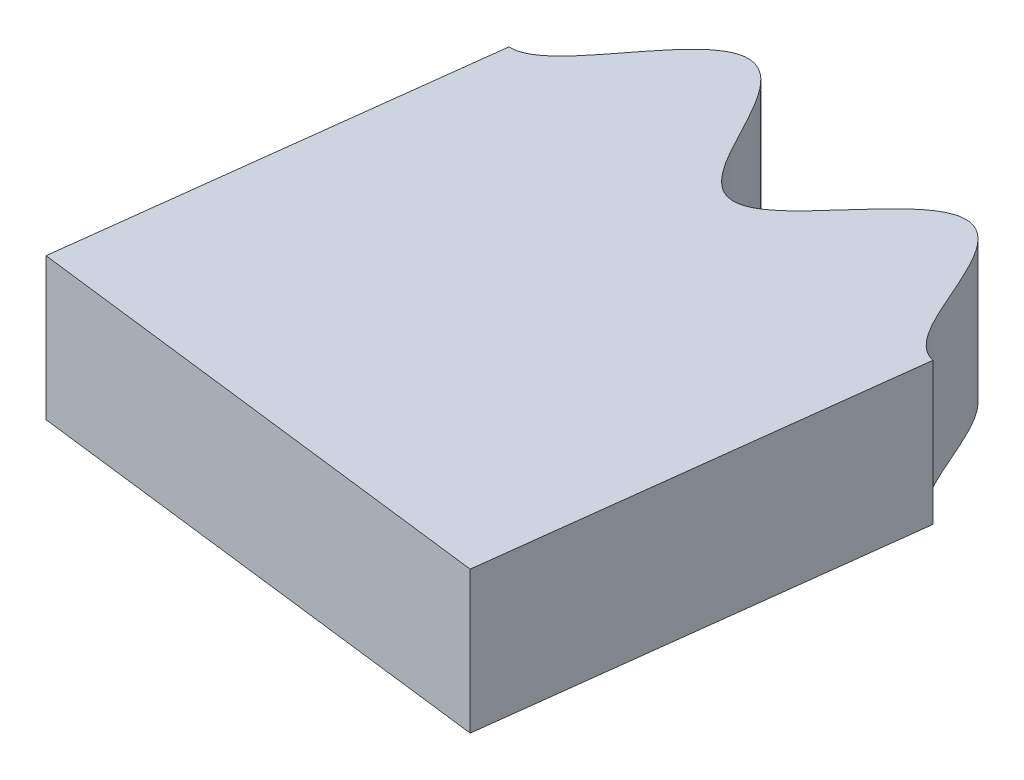
from build123d import *

# Parameters (mm, degrees)
BOSS_EXTRUDE1_DEPTH     = 3
CUT_EXTRUDE1_DEPTH      = 108.858671658
CUT_EXTRUDE1_DEPTH_BACK = 108.858671658
CUT_EXTRUDE2_START      = -3
CUT_EXTRUDE2_DEPTH      = 3
BOSS_EXTRUDE2_DEPTH     = 3


# Read off the part's stored shape, not the designer's step: Cut-Extrude2
with BuildPart() as part:
    # Sketch1 → Boss-Extrude1 (new body)
    with BuildSketch(Plane(origin=(0, 0, 0), x_dir=(1, 0, 0), z_dir=(0, 1, 0))):
        with BuildLine():
            Line((0, 75), (0, 65))
            ThreePointArc((0, 65), (45.961940777, 45.961940777), (65, 0))
            Line((65, 0), (75, 0))
            add(Edge.make_bspline(
                [(75, 0), (75.041112298, 0.027408199), (75.125245613, 0.083633523), (75.342933354, 0.230577442), (75.579476749, 0.400277398), (75.803954392, 0.581129453), (76.011836208, 0.790840237), (76.152032615, 0.978806109), (76.242410545, 1.19222257), (76.247194636, 1.417755828), (76.171590227, 1.621283712), (76.053040344, 1.792429827), (75.901720165, 1.952322234), (75.724822759, 2.103749443), (75.475174439, 2.288266037), (75.149562178, 2.499244919), (74.76260426, 2.733844059), (74.390525752, 2.967660926), (74.096998745, 3.180516485), (73.888021815, 3.373771754), (73.754852079, 3.533069478), (73.660678301, 3.715826875), (73.634383631, 3.916077063), (73.679915901, 4.107591164), (73.770283931, 4.275986246), (73.89449518, 4.439152777), (74.045788672, 4.598579928), (74.26557757, 4.798748111), (74.557807478, 5.033508593), (74.855966792, 5.260237371), (75.151185226, 5.491052123), (75.387608171, 5.691635418), (75.566675759, 5.859482286), (75.730748459, 6.039389733), (75.870288216, 6.236516843), (75.961581875, 6.45080996), (75.973056406, 6.672596723), (75.906427466, 6.870219289), (75.796783895, 7.031782356), (75.649110789, 7.183951163), (75.469925432, 7.327656175), (75.209020085, 7.502392039), (74.862370612, 7.698495981), (74.449730006, 7.911567611), (74.045765305, 8.125033195), (73.717888832, 8.324746291), (73.474215016, 8.516344263), (73.310194836, 8.687844958), (73.209978847, 8.874644977), (73.187392103, 9.054219472), (73.21525349, 9.232640914), (73.284935957, 9.401931792), (73.400574203, 9.579366787), (73.556680046, 9.766323154), (73.727550498, 9.942822403), (73.952817031, 10.156161772), (74.23307697, 10.405234115), (74.514063241, 10.65333411), (74.785870431, 10.911917317), (74.986481142, 11.131582376), (75.121662574, 11.30507905), (75.228863452, 11.479909983), (75.302210184, 11.65611955), (75.333173336, 11.858984022), (75.287269055, 12.074305866), (75.15847177, 12.268341055), (74.980105218, 12.432099829), (74.728460017, 12.606792631), (74.401490897, 12.782190319), (74.005435933, 12.96226152), (73.545966647, 13.159101964), (73.162792441, 13.336282191), (72.861677723, 13.505559024), (72.648318937, 13.666887707), (72.513794701, 13.801989012), (72.412981344, 13.965633699), (72.371963722, 14.15398098), (72.397238739, 14.344669957), (72.467507765, 14.522166656), (72.570326862, 14.69947357), (72.699548746, 14.877274653), (72.890625296, 15.105072213), (73.148030786, 15.377641411), (73.411870082, 15.643649024), (73.671714607, 15.913786401), (73.877113397, 16.146162464), (74.02997712, 16.338298376), (74.165497137, 16.540721782), (74.273001522, 16.75730721), (74.326194492, 16.981151402), (74.299446752, 17.194622932), (74.207844947, 17.370179186), (74.086475222, 17.505519053), (73.932240132, 17.628565522), (73.750457516, 17.740323675), (73.490079211, 17.871024763), (73.148041516, 18.010331828), (72.742635441, 18.15504136), (72.333783961, 18.299564956), (71.985228704, 18.438749066), (71.70124882, 18.580522318), (71.484211269, 18.720941323), (71.306471591, 18.895439186), (71.211655145, 19.112480641), (71.213690436, 19.332867892), (71.271629162, 19.528589428), (71.368375747, 19.727885068), (71.496696771, 19.930960938), (71.691975725, 20.19518494), (71.958922365, 20.515350742), (72.231412424, 20.830517708), (72.494647937, 21.153852313), (72.684260194, 21.422165122), (72.806947199, 21.628655642), (72.897284563, 21.830787556), (72.949258959, 22.027694797), (72.9483902, 22.242980954), (72.862768572, 22.453004372), (72.700947367, 22.62422926), (72.499570931, 22.758070634), (72.280988775, 22.865605493), (72.052538319, 22.95557), (71.758469571, 23.054113977), (71.398368953, 23.158137599), (71.036873596, 23.256587267), (70.677669314, 23.363936391), (70.398293383, 23.465676583), (70.197483409, 23.555045897), (70.019786006, 23.65718864), (69.870182882, 23.77577078), (69.752949584, 23.92827477), (69.694298319, 24.111897094), (69.699782913, 24.304024228), (69.748732194, 24.488287842), (69.852850212, 24.734680106), (70.028959091, 25.031841331), (70.272263328, 25.376858367), (70.534233789, 25.727055658), (70.753379001, 26.031183809), (70.923525506, 26.290634735), (71.04686175, 26.503046555), (71.150721004, 26.723540476), (71.223301141, 26.954542045), (71.238153459, 27.191377726), (71.165221919, 27.408965497), (71.023362715, 27.575720342), (70.853435387, 27.696006311), (70.656552657, 27.794499861), (70.438532503, 27.876292604), (70.140831352, 27.96429664), (69.762696965, 28.051186073), (69.31883777, 28.139289685), (68.889228305, 28.231747368), (68.540602233, 28.331373996), (68.278130966, 28.441500234), (68.098509316, 28.545644396), (67.947508202, 28.685170845), (67.854309696, 28.864351161), (67.831594354, 29.059888503), (67.858918015, 29.249035805), (67.919832168, 29.44484494), (68.00747425, 29.646402879), (68.145546704, 29.909671673), (68.339860179, 30.230222881), (68.542492477, 30.545254732), (68.740963766, 30.863120302), (68.894525136, 31.132468354), (69.005386617, 31.35143754), (69.098032551, 31.576611408), (69.161735589, 31.809575706), (69.174231004, 32.042169637), (69.109157996, 32.254505543), (68.978956374, 32.41742157), (68.820667296, 32.531740882), (68.629855171, 32.624225611), (68.412326004, 32.697979149), (68.10739199, 32.772942266), (67.71457654, 32.838658591), (67.253946418, 32.89774903), (66.80133424, 32.960177), (66.424925236, 33.035705563), (66.130416383, 33.132407411), (65.917631138, 33.237467143), (65.759569543, 33.378725855), (65.676926853, 33.539745562), (65.642084265, 33.716936029), (65.649663475, 33.899850226), (65.697641539, 34.10613519), (65.780390204, 34.335208051), (65.880589608, 34.55950423), (66.019304545, 34.837023353), (66.197474984, 35.166929341), (66.376660513, 35.496170039), (66.543635059, 35.832122305), (66.657017588, 36.107152844), (66.724707225, 36.316421161), (66.765647398, 36.517373358), (66.77430356, 36.708042248), (66.73401567, 36.909262517), (66.617235348, 37.095898676), (66.429841545, 37.234180845), (66.206223014, 37.327058803), (65.910005418, 37.405148613), (65.542765407, 37.458138501), (65.109007502, 37.491891304), (64.609924207, 37.519713065), (64.189259027, 37.555154721), (63.848407661, 37.611235612), (63.592738325, 37.689861983), (63.420119526, 37.770805683), (63.269416179, 37.89010119), (63.166453658, 38.053060886), (63.124984934, 38.240894476), (63.130308773, 38.431720236), (63.166284583, 38.633500438), (63.22690188, 38.844775291), (63.328543759, 39.124187005), (63.47720162, 39.468356136), (63.634149536, 39.808559872), (63.785931033, 40.151278046), (63.899465715, 40.439890622), (63.977394027, 40.672721895), (64.035519447, 40.909287616), (64.062433284, 41.149582493), (64.035284076, 41.383605964), (63.929433326, 41.584196387), (63.765072988, 41.72324517), (63.580824793, 41.810000008), (63.367915025, 41.870725461), (63.130872424, 41.909471311), (62.803452477, 41.936688044), (62.386559274, 41.94287342), (61.969974138, 41.936719345), (61.553122911, 41.938024966), (61.225192691, 41.958272522), (60.987144385, 41.990507568), (60.772287561, 42.044500152), (60.585113871, 42.125923892), (60.414979182, 42.266026963), (60.309662618, 42.478172132), (60.290238363, 42.726493689), (60.322180213, 42.983013696), (60.396114351, 43.291684998), (60.513540138, 43.648159637), (60.665633306, 44.054256018), (60.815369375, 44.457832583), (60.928511564, 44.809393514), (60.99575667, 45.092867907), (61.026992571, 45.303958226), (61.031873913, 45.501201906), (61.006212515, 45.681171299), (60.930609128, 45.864187738), (60.784273564, 46.02189455), (60.578607182, 46.125030643), (60.343590632, 46.181895936), (60.101414719, 46.208196838), (59.855971164, 46.214599016), (59.545932975, 46.206622868), (59.171970898, 46.181211372), (58.798604614, 46.150085143), (58.424347435, 46.128105202), (58.127022741, 46.128157521), (57.907756983, 46.143456148), (57.705841165, 46.178662838), (57.524702746, 46.23892632), (57.362380046, 46.342137045), (57.244463278, 46.494625665), (57.183905752, 46.677041955), (57.16688266, 46.866934943), (57.180442102, 47.134077334), (57.244321336, 47.473553641), (57.354893039, 47.880971366), (57.499445675, 48.359471859), (57.616082356, 48.7786151), (57.69189163, 49.141831437), (57.719823597, 49.446893215), (57.709028908, 49.688792031), (57.643178629, 49.912179891), (57.50773923, 50.085750824), (57.332433298, 50.192430443), (57.150302566, 50.249508911), (56.947466903, 50.279767431), (56.727667839, 50.287733986), (56.430444367, 50.275255132), (56.057644353, 50.233253122), (55.686973228, 50.177480147), (55.31602689, 50.122890282), (55.007795866, 50.087455177), (54.76278633, 50.070025875), (54.519099912, 50.070566496), (54.279131024, 50.099783795), (54.076955349, 50.171870632), (53.934932159, 50.286532738), (53.834139437, 50.434480373), (53.774948775, 50.603748659), (53.752200542, 50.810402358), (53.762075931, 51.120092353), (53.819834522, 51.49970215), (53.915977976, 51.946327193), (54.01799353, 52.399414031), (54.090592347, 52.791003136), (54.12444314, 53.103191817), (54.129536996, 53.332825828), (54.10789134, 53.543762544), (54.054604379, 53.731605135), (53.946044969, 53.909675187), (53.768770765, 54.043446969), (53.54593028, 54.111256933), (53.305227727, 54.131074139), (53.061946728, 54.121029438), (52.818266141, 54.091745594), (52.512640682, 54.039567568), (52.146063572, 53.961781989), (51.78072614, 53.879117154), (51.413047411, 53.806157184), (51.11843211, 53.76645475), (50.899054249, 53.75303501), (50.694219946, 53.762765078), (50.507134453, 53.801781462), (50.331158554, 53.890004608), (50.194659852, 54.038865809), (50.115191137, 54.228480154), (50.078778902, 54.432897686), (50.068117137, 54.652502885), (50.077011591, 54.885074998), (50.106493648, 55.194018265), (50.160603335, 55.578093956), (50.229645527, 56.025340494), (50.28090212, 56.461946341), (50.29159071, 56.824735734), (50.259051977, 57.107868259), (50.204119123, 57.308676581), (50.09594215, 57.499015661), (49.916420488, 57.641968235), (49.688787939, 57.709014187), (49.446893555, 57.719818331), (49.204175127, 57.697635942), (48.962389812, 57.654386896), (48.660392163, 57.583238926), (48.299653106, 57.48132774), (47.880976121, 57.354930559), (47.473551208, 57.244302139), (47.134078214, 57.18044905), (46.866934762, 57.166881235), (46.677041964, 57.183905824), (46.494625673, 57.244463341), (46.342137044, 57.362380036), (46.238926319, 57.524702737), (46.178662839, 57.70584117), (46.143456148, 57.907756983), (46.128157519, 58.12702274), (46.128105208, 58.424347436), (46.150085128, 58.798604612), (46.181211396, 59.1719709), (46.20662283, 59.545932969), (46.214599218, 59.855971225), (46.208194892, 60.101414107), (46.181904679, 60.343593234), (46.125009725, 60.578601631), (46.019457073, 60.789226184), (45.851383939, 60.941516435), (45.649378258, 61.015965004), (45.446569687, 61.034471291), (45.225730621, 61.018715122), (44.989731576, 60.974050966), (44.672748797, 60.887642113), (44.278881807, 60.750868592), (43.889524646, 60.602605145), (43.497366076, 60.461260511), (43.182287396, 60.368128249), (42.947570124, 60.317001968), (42.727204201, 60.29425304), (42.523469907, 60.306749154), (42.315677523, 60.380213486), (42.144154403, 60.54354435), (42.0409706, 60.770246798), (41.983251111, 61.022221511), (41.947154672, 61.33756462), (41.93557731, 61.712703193), (41.939604996, 62.146327892), (41.94227956, 62.576778564), (41.92835752, 62.945834685), (41.894593297, 63.235212661), (41.851748302, 63.444255984), (41.788873951, 63.631273931), (41.703206967, 63.791613126), (41.569567714, 63.937734442), (41.378118358, 64.035880659), (41.149580555, 64.06245484), (40.909288162, 64.035510342), (40.672721805, 63.977396064), (40.439890634, 63.899465504), (40.151278039, 63.785931071), (39.808559877, 63.634149513), (39.468356133, 63.477201635), (39.124187006, 63.328543752), (38.844775291, 63.226901882), (38.633500438, 63.166284583), (38.431720236, 63.130308773), (38.240894476, 63.124984934), (38.053060886, 63.166453658), (37.89010119, 63.269416179), (37.770805683, 63.420119526), (37.689861983, 63.592738325), (37.611235612, 63.848407661), (37.555154721, 64.189259027), (37.519713065, 64.609924207), (37.491891304, 65.109007502), (37.458138501, 65.542765407), (37.405148613, 65.910005418), (37.327058803, 66.206223014), (37.234180845, 66.429841545), (37.095898676, 66.617235347), (36.909262517, 66.73401567), (36.708042248, 66.77430356), (36.517373357, 66.765647397), (36.316421158, 66.724707222), (36.107152877, 66.657017627), (35.832122193, 66.543634926), (35.496170304, 66.376660833), (35.166928865, 66.197474389), (34.837024161, 66.019305576), (34.559501263, 65.88058625), (34.335228782, 65.780409867), (34.106053549, 65.697572221), (33.870563651, 65.642953308), (33.655925511, 65.641544623), (33.483250618, 65.700716966), (33.337935369, 65.805269126), (33.224421178, 65.944084887), (33.132365104, 66.130495488), (33.035724717, 66.424886473), (32.960165842, 66.8013576), (32.897756374, 67.253930855), (32.838654813, 67.714584588), (32.772944024, 68.107388238), (32.697978546, 68.412327291), (32.624225748, 68.629854878), (32.531740879, 68.820667302), (32.417421565, 68.978956386), (32.254505544, 69.109157995), (32.042169638, 69.174231002), (31.809575706, 69.16173559), (31.576611409, 69.098032551), (31.35143754, 69.005386617), (31.132468354, 68.894525136), (30.863120302, 68.740963766), (30.545254731, 68.542492476), (30.230222881, 68.33986018), (29.909671672, 68.145546703), (29.64640288, 68.007474251), (29.444844944, 67.919832173), (29.249035782, 67.858917989), (29.059888535, 67.83159439), (28.864351189, 67.854309727), (28.685170837, 67.947508193), (28.545642747, 68.098507493), (28.441511524, 68.278143421), (28.356383341, 68.480858268), (28.285197045, 68.702446649), (28.207236296, 69.002841814), (28.126721148, 69.38226151), (28.038632261, 69.826149602), (27.937469709, 70.253955682), (27.823432418, 70.59852191), (27.696018983, 70.853450552), (27.575718495, 71.023360508), (27.408965593, 71.165222033), (27.191377751, 71.238153488), (26.954542059, 71.223301157), (26.723540456, 71.15072098), (26.503046564, 71.046861761), (26.290634733, 70.923525504), (26.03118381, 70.753379002), (25.727055658, 70.534233789), (25.376858367, 70.272263328), (25.031841331, 70.028959091), (24.734680106, 69.852850212), (24.488287841, 69.748732194), (24.304024228, 69.699782913), (24.111897094, 69.694298319), (23.92827477, 69.752949584), (23.77577078, 69.870182882), (23.65718864, 70.019786006), (23.555045897, 70.197483409), (23.465676583, 70.398293383), (23.363936391, 70.677669314), (23.256587267, 71.036873596), (23.158137599, 71.398368953), (23.054113977, 71.758469571), (22.95557, 72.052538319), (22.865605493, 72.280988775), (22.758070634, 72.499570931), (22.62422926, 72.700947367), (22.453004372, 72.862768572), (22.242980954, 72.9483902), (22.027694797, 72.949258959), (21.830787556, 72.897284563), (21.628655642, 72.806947199), (21.422165122, 72.684260194), (21.153852313, 72.494647937), (20.830517708, 72.231412424), (20.515350742, 71.958922365), (20.19518494, 71.691975725), (19.930960938, 71.496696771), (19.727885068, 71.368375747), (19.528589428, 71.271629162), (19.332867892, 71.213690436), (19.112480641, 71.211655145), (18.895439186, 71.306471591), (18.720941323, 71.484211269), (18.580522318, 71.70124882), (18.438749066, 71.985228704), (18.299564956, 72.333783961), (18.15504136, 72.742635441), (18.010331828, 73.148041516), (17.871024763, 73.490079211), (17.740323675, 73.750457516), (17.628565522, 73.932240132), (17.505519053, 74.086475222), (17.370179186, 74.207844947), (17.194622932, 74.299446752), (16.981151402, 74.326194492), (16.75730721, 74.273001522), (16.540721782, 74.165497137), (16.338298376, 74.02997712), (16.146162464, 73.877113397), (15.913786401, 73.671714607), (15.643649024, 73.411870082), (15.377641411, 73.148030786), (15.105072213, 72.890625296), (14.877274653, 72.699548746), (14.69947357, 72.570326862), (14.522166656, 72.467507765), (14.344669957, 72.397238739), (14.15398098, 72.371963722), (13.965633699, 72.412981344), (13.801989012, 72.513794701), (13.666887707, 72.648318937), (13.505559024, 72.861677723), (13.336282191, 73.162792441), (13.159101964, 73.545966647), (12.96226152, 74.005435933), (12.782190319, 74.401490897), (12.606792631, 74.728460017), (12.432099829, 74.980105218), (12.268341055, 75.15847177), (12.074305866, 75.287269055), (11.858984022, 75.333173337), (11.65611955, 75.302210184), (11.479909982, 75.22886345), (11.305079048, 75.12166257), (11.131582394, 74.98648119), (10.911917257, 74.785870268), (10.653334249, 74.514063632), (10.405233872, 74.233076248), (10.156162179, 73.952818275), (9.942820763, 73.727546327), (9.766335909, 73.556705613), (9.579313777, 73.400481143), (9.376706426, 73.268613864), (9.175494349, 73.193879567), (8.992994892, 73.190425089), (8.820684281, 73.23897124), (8.666538046, 73.330591246), (8.516277452, 73.474274881), (8.324777547, 73.717858958), (8.125014721, 74.04578344), (7.911579835, 74.449717894), (7.698489678, 74.862376883), (7.502394974, 75.20901716), (7.327655169, 75.469926435), (7.183951393, 75.64911056), (7.031782351, 75.7967839), (6.87021928, 75.906427475), (6.672596724, 75.973056405), (6.450809961, 75.961581874), (6.236516842, 75.870288217), (6.039389734, 75.730748458), (5.859482286, 75.566675759), (5.691635418, 75.387608171), (5.491052123, 75.151185226), (5.26023737, 74.855966792), (5.033508593, 74.557807479), (4.79874811, 74.265577568), (4.598579929, 74.045788674), (4.43915278, 73.894495187), (4.275986233, 73.770283899), (4.107591182, 73.679915946), (3.916077078, 73.634383669), (3.715826871, 73.660678291), (3.533068552, 73.754849801), (3.373778104, 73.888037381), (3.224451219, 74.049411477), (3.081770284, 74.233289275), (2.905769975, 74.488904322), (2.700341234, 74.817904233), (2.465746233, 75.204894778), (2.224365995, 75.572300773), (1.9993578, 75.857085081), (1.792436567, 76.053058972), (1.621282728, 76.171587513), (1.417755871, 76.247194756), (1.192222585, 76.242410586), (0.978806117, 76.152032639), (0.790840226, 76.011836177), (0.58112946, 75.803954411), (0.400277395, 75.57947674), (0.230577443, 75.342933357), (0.083633523, 75.125245613), (0.027408199, 75.041112298), (0, 75)],
                knots=[0.077452672, 0.077452672, 0.077452672, 0.077452672, 0.077452672, 0.078625649, 0.079798627, 0.082144582, 0.08331756, 0.084490537, 0.085663515, 0.086836493, 0.087872675, 0.088908858, 0.089945041, 0.090981224, 0.092278052, 0.093574881, 0.096168538, 0.098762196, 0.101355853, 0.102391788, 0.103427722, 0.104463657, 0.105499592, 0.106449186, 0.10739878, 0.108348374, 0.109297968, 0.110550679, 0.11180339, 0.114308811, 0.116814233, 0.118066944, 0.119319655, 0.120527329, 0.121735003, 0.122942678, 0.124150352, 0.125119735, 0.126089119, 0.127058503, 0.128027886, 0.129358791, 0.130689696, 0.133351506, 0.136013315, 0.138675125, 0.13985721, 0.141039294, 0.142221379, 0.143403464, 0.144008045, 0.144612626, 0.145821788, 0.147030951, 0.148240113, 0.149493641, 0.150747169, 0.153254225, 0.155761281, 0.157014809, 0.158268337, 0.159217833, 0.16016733, 0.161116827, 0.162066323, 0.163275136, 0.164483949, 0.165692762, 0.166901575, 0.169408126, 0.171914676, 0.174421227, 0.176927777, 0.177877176, 0.178826575, 0.179775974, 0.180725373, 0.181674956, 0.18262454, 0.183574123, 0.184523706, 0.18577669, 0.187029673, 0.189535639, 0.192041606, 0.193294589, 0.194547572, 0.195755776, 0.19696398, 0.198172183, 0.199380387, 0.200283821, 0.201187256, 0.20209069, 0.202994124, 0.204227947, 0.20546177, 0.207929416, 0.210397062, 0.212864708, 0.214160334, 0.215455959, 0.216751585, 0.218047211, 0.219060591, 0.220073972, 0.221087353, 0.222100734, 0.223494094, 0.224887455, 0.227674176, 0.230460897, 0.231854258, 0.233247618, 0.234259895, 0.235272172, 0.236284448, 0.237296725, 0.238504929, 0.239713132, 0.240921336, 0.24212954, 0.243382523, 0.244635506, 0.247141473, 0.249647439, 0.250900422, 0.252153406, 0.253102989, 0.254052573, 0.255002156, 0.255951739, 0.256901138, 0.257850537, 0.258799936, 0.259749335, 0.262255885, 0.264762436, 0.267268986, 0.268522261, 0.269775537, 0.27098435, 0.272193163, 0.273401976, 0.274610789, 0.275646971, 0.276683154, 0.277719337, 0.27875552, 0.280052348, 0.281349177, 0.283942834, 0.286536492, 0.289130149, 0.290166084, 0.291202018, 0.292237953, 0.293273888, 0.294223482, 0.295173076, 0.29612267, 0.297072264, 0.298324975, 0.299577686, 0.302083107, 0.304588529, 0.30584124, 0.307093951, 0.308301625, 0.309509299, 0.310716974, 0.311924648, 0.312894031, 0.313863415, 0.314832799, 0.315802182, 0.317133087, 0.318463992, 0.321125802, 0.323787611, 0.326449421, 0.327631505, 0.32881359, 0.329995675, 0.33117776, 0.331782341, 0.332386922, 0.333596084, 0.334805247, 0.336014409, 0.337267937, 0.338521465, 0.341028521, 0.343535577, 0.344789105, 0.346042633, 0.346992129, 0.347941626, 0.348891123, 0.349840619, 0.351049432, 0.352258245, 0.353467058, 0.354675871, 0.357182422, 0.359688972, 0.362195523, 0.364702073, 0.365651472, 0.366600871, 0.36755027, 0.368499669, 0.369449252, 0.370398835, 0.371348419, 0.372298002, 0.373550986, 0.374803969, 0.377309935, 0.379815902, 0.381068885, 0.382321868, 0.383530072, 0.384738276, 0.385946479, 0.387154683, 0.38816696, 0.389179236, 0.390191513, 0.39120379, 0.39259715, 0.393990511, 0.396777232, 0.399563953, 0.400957314, 0.402350674, 0.403364055, 0.404377436, 0.405390817, 0.406404197, 0.407699823, 0.408995449, 0.410291074, 0.4115867, 0.414054346, 0.416521992, 0.418989638, 0.420223461, 0.421457284, 0.422360718, 0.423264152, 0.424167587, 0.425071021, 0.426279225, 0.427487428, 0.428695632, 0.429903836, 0.431156819, 0.432409802, 0.434915769, 0.437421735, 0.438674718, 0.439927702, 0.440877285, 0.441826869, 0.442776452, 0.443726035, 0.444675434, 0.445624833, 0.446574232, 0.447523631, 0.450030181, 0.452536732, 0.455043282, 0.457549833, 0.458758646, 0.459967459, 0.461176272, 0.462385085, 0.463334581, 0.464284078, 0.465233575, 0.466183071, 0.467436599, 0.468690127, 0.471197183, 0.473704239, 0.474957767, 0.476211295, 0.477420457, 0.47862962, 0.479838782, 0.481047944, 0.481638987, 0.482230029, 0.483412114, 0.484594199, 0.485776283, 0.488438093, 0.491099902, 0.493761712, 0.495092617, 0.496423522, 0.497392905, 0.498362289, 0.499331673, 0.500301056, 0.50150873, 0.502716405, 0.503924079, 0.505131753, 0.506384464, 0.507637175, 0.510142597, 0.512648018, 0.513900729, 0.51515344, 0.516103034, 0.517052628, 0.518002222, 0.518951816, 0.519987751, 0.521023686, 0.52205962, 0.523095555, 0.524392384, 0.525689213, 0.52828287, 0.530876527, 0.533470184, 0.534506367, 0.53554255, 0.536578733, 0.537614915, 0.538823728, 0.540032541, 0.541241354, 0.542450167, 0.543703443, 0.544956718, 0.547463268, 0.549969819, 0.552476369, 0.553425768, 0.554375167, 0.555324566, 0.556273965, 0.557223548, 0.558173131, 0.559122715, 0.560072298, 0.561325282, 0.562578265, 0.565084231, 0.567590198, 0.568843181, 0.570096164, 0.571304368, 0.572512572, 0.573720775, 0.574928979, 0.575941256, 0.576953532, 0.577965809, 0.578978086, 0.580371446, 0.581764807, 0.584551528, 0.587338249, 0.58873161, 0.59012497, 0.591138351, 0.592151732, 0.593165113, 0.594178493, 0.595474119, 0.596769745, 0.59806537, 0.599360996, 0.601828642, 0.604296288, 0.606763934, 0.607997757, 0.60923158, 0.610135014, 0.611038448, 0.611941883, 0.612845317, 0.614053521, 0.615261724, 0.616469928, 0.617678132, 0.618931115, 0.620184098, 0.622690065, 0.625196031, 0.626449014, 0.627701998, 0.628651581, 0.629601165, 0.630550748, 0.631500331, 0.63244973, 0.633399129, 0.634348528, 0.635297927, 0.637804477, 0.640311028, 0.642817578, 0.645324129, 0.646532942, 0.647741755, 0.648950568, 0.650159381, 0.651108877, 0.652058374, 0.653007871, 0.653957367, 0.655210895, 0.656464423, 0.658971479, 0.661478535, 0.662732063, 0.663985591, 0.665194753, 0.666403916, 0.667613078, 0.66882224, 0.669413283, 0.670004325, 0.67118641, 0.672368495, 0.673550579, 0.676212389, 0.678874198, 0.681536008, 0.682866913, 0.684197818, 0.685167201, 0.686136585, 0.687105969, 0.688075352, 0.689283026, 0.690490701, 0.691698375, 0.692906049, 0.69415876, 0.695411471, 0.697916893, 0.700422314, 0.701675025, 0.702927736, 0.70387733, 0.704826924, 0.705776518, 0.706726112, 0.707762047, 0.708797982, 0.709833916, 0.710869851, 0.71216668, 0.713463508, 0.716057166, 0.718650823, 0.72124448, 0.722280663, 0.723316846, 0.724353029, 0.725389211, 0.726598024, 0.727806837, 0.72901565, 0.730224463, 0.731477739, 0.732731014, 0.735237564, 0.737744115, 0.740250665, 0.741200064, 0.742149463, 0.743098862, 0.744048261, 0.744997844, 0.745947427, 0.746897011, 0.747846594, 0.749099578, 0.750352561, 0.752858527, 0.755364494, 0.756617477, 0.75787046, 0.759078664, 0.760286868, 0.761495071, 0.762703275, 0.763715552, 0.764727828, 0.765740105, 0.766752382, 0.768145742, 0.769539103, 0.772325824, 0.775112545, 0.776505906, 0.777899266, 0.778912647, 0.779926028, 0.780939409, 0.781952789, 0.783248415, 0.784544041, 0.785839666, 0.787135292, 0.789602938, 0.792070584, 0.79453823, 0.795772053, 0.797005876, 0.79790931, 0.798812744, 0.799716179, 0.800619613, 0.801827817, 0.80303602, 0.804244224, 0.805452428, 0.806705411, 0.807958394, 0.810464361, 0.812970327, 0.81422331, 0.815476294, 0.816425877, 0.81737546, 0.818325044, 0.819274627, 0.820224026, 0.821173425, 0.822122824, 0.823072223, 0.825578773, 0.828085324, 0.830591874, 0.833098425, 0.834307238, 0.835516051, 0.836724864, 0.837933677, 0.838883173, 0.83983267, 0.840782167, 0.841731663, 0.842985191, 0.844238719, 0.846745775, 0.849252831, 0.850506359, 0.851759887, 0.852969049, 0.854178212, 0.855387374, 0.856596536, 0.857187579, 0.857778621, 0.858960706, 0.86014279, 0.861324875, 0.863986685, 0.866648494, 0.869310304, 0.870641209, 0.871972114, 0.872941497, 0.873910881, 0.874880265, 0.875849648, 0.877057322, 0.878264997, 0.879472671, 0.880680345, 0.881933056, 0.883185767, 0.885691189, 0.88819661, 0.889449321, 0.890702032, 0.891651626, 0.89260122, 0.893550814, 0.894500408, 0.895536343, 0.896572278, 0.897608212, 0.898644147, 0.899940976, 0.901237804, 0.903831462, 0.906425119, 0.909018776, 0.910054959, 0.911091142, 0.912127325, 0.913163507, 0.914336485, 0.915509463, 0.91668244, 0.917855418, 0.920201373, 0.921374351, 0.922547328, 0.922547328, 0.922547328, 0.922547328, 0.922547328], degree=4))
        make_face()
    extrude(amount=BOSS_EXTRUDE1_DEPTH)

    # Sketch2 → Cut-Extrude1 (cut, two sides: drawn at the far end of the back side and taken through both)
    with BuildSketch(Plane(origin=(0, 3, 0), x_dir=(1, 0, 0), z_dir=(0, 1, 0)).offset(-CUT_EXTRUDE1_DEPTH_BACK)):
        with BuildLine():
            Line((3.859797928, 73.649331844), (2.790435771, 64.940075979))
            ThreePointArc((2.790435771, 64.940075979), (1.395539562, 64.985017268), (0, 65))
            Line((0, 65), (0, 75))
            add(Edge.make_bspline(
                [(3.859797928, 73.649331844), (3.851133293, 73.649790592), (3.791090099, 73.654234452), (3.680914147, 73.678668082), (3.533068552, 73.754849801), (3.373778104, 73.888037381), (3.224451219, 74.049411477), (3.081770284, 74.233289275), (2.905769975, 74.488904322), (2.700341234, 74.817904233), (2.465746233, 75.204894778), (2.224365995, 75.572300773), (1.9993578, 75.857085081), (1.792436567, 76.053058972), (1.621282728, 76.171587513), (1.417755871, 76.247194756), (1.192222585, 76.242410586), (0.978806117, 76.152032639), (0.790840226, 76.011836177), (0.58112946, 75.803954411), (0.400277395, 75.57947674), (0.230577443, 75.342933357), (0.083633523, 75.125245613), (0.027408199, 75.041112298), (0, 75)],
                knots=[0.894325908, 0.894325908, 0.894325908, 0.894325908, 0.894325908, 0.894500408, 0.895536343, 0.896572278, 0.897608212, 0.898644147, 0.899940976, 0.901237804, 0.903831462, 0.906425119, 0.909018776, 0.910054959, 0.911091142, 0.912127325, 0.913163507, 0.914336485, 0.915509463, 0.91668244, 0.917855418, 0.920201373, 0.921374351, 0.922547328, 0.922547328, 0.922547328, 0.922547328, 0.922547328], degree=4))
        make_face()
    extrude(amount=CUT_EXTRUDE1_DEPTH + CUT_EXTRUDE1_DEPTH_BACK, mode=Mode.SUBTRACT)

    # Cut-Extrude2 outline → Cut-Extrude2 (cut)
    with BuildSketch(Plane(origin=(0, 3, 0), x_dir=(1, 0, 0), z_dir=(0, 1, 0)).offset(CUT_EXTRUDE2_START)):
        with BuildLine():
            add(Edge.make_bspline(
                [(75, 0), (75.041112298, 0.027408199), (75.125245613, 0.083633523), (75.342933354, 0.230577442), (75.579476749, 0.400277398), (75.803954392, 0.581129453), (76.011836208, 0.790840237), (76.152032615, 0.978806109), (76.242410545, 1.19222257), (76.247194636, 1.417755828), (76.171590227, 1.621283712), (76.053040344, 1.792429827), (75.901720165, 1.952322234), (75.724822759, 2.103749443), (75.475174439, 2.288266037), (75.149562178, 2.499244919), (74.76260426, 2.733844059), (74.390525752, 2.967660926), (74.096998745, 3.180516485), (73.888021815, 3.373771754), (73.754852079, 3.533069478), (73.660678301, 3.715826875), (73.634383631, 3.916077063), (73.679915901, 4.107591164), (73.770283931, 4.275986246), (73.89449518, 4.439152777), (74.045788672, 4.598579928), (74.26557757, 4.798748111), (74.557807478, 5.033508593), (74.855966792, 5.260237371), (75.151185226, 5.491052123), (75.387608171, 5.691635418), (75.566675759, 5.859482286), (75.730748459, 6.039389733), (75.870288216, 6.236516843), (75.961581875, 6.45080996), (75.973056406, 6.672596723), (75.906427466, 6.870219289), (75.796783895, 7.031782356), (75.649110789, 7.183951163), (75.469925432, 7.327656175), (75.209020085, 7.502392039), (74.862370612, 7.698495981), (74.449730006, 7.911567611), (74.045765305, 8.125033195), (73.717888832, 8.324746291), (73.474215016, 8.516344263), (73.310194836, 8.687844958), (73.209978847, 8.874644977), (73.187392103, 9.054219472), (73.21525349, 9.232640914), (73.284935957, 9.401931792), (73.400574203, 9.579366787), (73.556680046, 9.766323154), (73.727550498, 9.942822403), (73.952817031, 10.156161772), (74.23307697, 10.405234115), (74.514063241, 10.65333411), (74.785870431, 10.911917317), (74.986481142, 11.131582376), (75.121662574, 11.30507905), (75.228863452, 11.479909983), (75.302210184, 11.65611955), (75.333173336, 11.858984022), (75.287269055, 12.074305866), (75.15847177, 12.268341055), (74.980105218, 12.432099829), (74.728460017, 12.606792631), (74.401490897, 12.782190319), (74.005435933, 12.96226152), (73.545966647, 13.159101964), (73.162792441, 13.336282191), (72.861677723, 13.505559024), (72.648318937, 13.666887707), (72.513794701, 13.801989012), (72.412981344, 13.965633699), (72.371963722, 14.15398098), (72.397238739, 14.344669957), (72.467507765, 14.522166656), (72.570326862, 14.69947357), (72.699548746, 14.877274653), (72.890625296, 15.105072213), (73.148030786, 15.377641411), (73.411870082, 15.643649024), (73.671714607, 15.913786401), (73.877113397, 16.146162464), (74.02997712, 16.338298376), (74.165497137, 16.540721782), (74.273001522, 16.75730721), (74.326194492, 16.981151402), (74.299446752, 17.194622932), (74.207844947, 17.370179186), (74.086475222, 17.505519053), (73.932240132, 17.628565522), (73.750457516, 17.740323675), (73.490079211, 17.871024763), (73.148041516, 18.010331828), (72.742635441, 18.15504136), (72.333783961, 18.299564956), (71.985228704, 18.438749066), (71.70124882, 18.580522318), (71.484211269, 18.720941323), (71.306471591, 18.895439186), (71.211655145, 19.112480641), (71.213690436, 19.332867892), (71.271629162, 19.528589428), (71.368375747, 19.727885068), (71.496696771, 19.930960938), (71.691975725, 20.19518494), (71.958922365, 20.515350742), (72.231412424, 20.830517708), (72.494647937, 21.153852313), (72.684260194, 21.422165122), (72.806947199, 21.628655642), (72.897284563, 21.830787556), (72.949258959, 22.027694797), (72.9483902, 22.242980954), (72.862768572, 22.453004372), (72.700947367, 22.62422926), (72.499570931, 22.758070634), (72.280988775, 22.865605493), (72.052538319, 22.95557), (71.758469571, 23.054113977), (71.398368953, 23.158137599), (71.036873596, 23.256587267), (70.677669314, 23.363936391), (70.398293383, 23.465676583), (70.197483409, 23.555045897), (70.019786006, 23.65718864), (69.870182882, 23.77577078), (69.752949584, 23.92827477), (69.694298319, 24.111897094), (69.699782913, 24.304024228), (69.748732194, 24.488287842), (69.852850212, 24.734680106), (70.028959091, 25.031841331), (70.272263328, 25.376858367), (70.534233789, 25.727055658), (70.753379001, 26.031183809), (70.923525506, 26.290634735), (71.04686175, 26.503046555), (71.150721004, 26.723540476), (71.223301141, 26.954542045), (71.238153459, 27.191377726), (71.165221919, 27.408965497), (71.023362715, 27.575720342), (70.853435387, 27.696006311), (70.656552657, 27.794499861), (70.438532503, 27.876292604), (70.140831352, 27.96429664), (69.762696965, 28.051186073), (69.31883777, 28.139289685), (68.889228305, 28.231747368), (68.540602233, 28.331373996), (68.278130966, 28.441500234), (68.098509316, 28.545644396), (67.947508202, 28.685170845), (67.854309696, 28.864351161), (67.831594354, 29.059888503), (67.858918015, 29.249035805), (67.919832168, 29.44484494), (68.00747425, 29.646402879), (68.145546704, 29.909671673), (68.339860179, 30.230222881), (68.542492477, 30.545254732), (68.740963766, 30.863120302), (68.894525136, 31.132468354), (69.005386617, 31.35143754), (69.098032551, 31.576611408), (69.161735589, 31.809575706), (69.174231004, 32.042169637), (69.109157996, 32.254505543), (68.978956374, 32.41742157), (68.820667296, 32.531740882), (68.629855171, 32.624225611), (68.412326004, 32.697979149), (68.10739199, 32.772942266), (67.71457654, 32.838658591), (67.253946418, 32.89774903), (66.80133424, 32.960177), (66.424925236, 33.035705563), (66.130416383, 33.132407411), (65.917631138, 33.237467143), (65.759569543, 33.378725855), (65.676926853, 33.539745562), (65.642084265, 33.716936029), (65.649663475, 33.899850226), (65.697641539, 34.10613519), (65.780390204, 34.335208051), (65.880589608, 34.55950423), (66.019304545, 34.837023353), (66.197474984, 35.166929341), (66.376660513, 35.496170039), (66.543635059, 35.832122305), (66.657017588, 36.107152844), (66.724707225, 36.316421161), (66.765647398, 36.517373358), (66.77430356, 36.708042248), (66.73401567, 36.909262517), (66.617235348, 37.095898676), (66.429841545, 37.234180845), (66.206223014, 37.327058803), (65.910005418, 37.405148613), (65.542765407, 37.458138501), (65.109007502, 37.491891304), (64.609924207, 37.519713065), (64.189259027, 37.555154721), (63.848407661, 37.611235612), (63.592738325, 37.689861983), (63.420119526, 37.770805683), (63.269416179, 37.89010119), (63.166453658, 38.053060886), (63.124984934, 38.240894476), (63.130308773, 38.431720236), (63.166284583, 38.633500438), (63.22690188, 38.844775291), (63.328543759, 39.124187005), (63.47720162, 39.468356136), (63.634149536, 39.808559872), (63.785931033, 40.151278046), (63.899465715, 40.439890622), (63.977394027, 40.672721895), (64.035519447, 40.909287616), (64.062433284, 41.149582493), (64.035284076, 41.383605964), (63.929433326, 41.584196387), (63.765072988, 41.72324517), (63.580824793, 41.810000008), (63.367915025, 41.870725461), (63.130872424, 41.909471311), (62.803452477, 41.936688044), (62.386559274, 41.94287342), (61.969974138, 41.936719345), (61.553122911, 41.938024966), (61.225192691, 41.958272522), (60.987144385, 41.990507568), (60.772287561, 42.044500152), (60.585113871, 42.125923892), (60.414979182, 42.266026963), (60.309662618, 42.478172132), (60.290238363, 42.726493689), (60.322180213, 42.983013696), (60.396114351, 43.291684998), (60.513540138, 43.648159637), (60.665633306, 44.054256018), (60.815369375, 44.457832583), (60.928511564, 44.809393514), (60.99575667, 45.092867907), (61.026992571, 45.303958226), (61.031873913, 45.501201906), (61.006212515, 45.681171299), (60.930609128, 45.864187738), (60.784273564, 46.02189455), (60.578607182, 46.125030643), (60.343590632, 46.181895936), (60.101414719, 46.208196838), (59.855971164, 46.214599016), (59.545932975, 46.206622868), (59.171970898, 46.181211372), (58.798604614, 46.150085143), (58.424347435, 46.128105202), (58.127022741, 46.128157521), (57.907756983, 46.143456148), (57.705841165, 46.178662838), (57.524702746, 46.23892632), (57.362380046, 46.342137045), (57.244463278, 46.494625665), (57.183905752, 46.677041955), (57.16688266, 46.866934943), (57.180442102, 47.134077334), (57.244321336, 47.473553641), (57.354893039, 47.880971366), (57.499445675, 48.359471859), (57.616082356, 48.7786151), (57.69189163, 49.141831437), (57.719823597, 49.446893215), (57.709028908, 49.688792031), (57.643178629, 49.912179891), (57.50773923, 50.085750824), (57.332433298, 50.192430443), (57.150302566, 50.249508911), (56.947466903, 50.279767431), (56.727667839, 50.287733986), (56.430444367, 50.275255132), (56.057644353, 50.233253122), (55.686973228, 50.177480147), (55.31602689, 50.122890282), (55.007795866, 50.087455177), (54.76278633, 50.070025875), (54.519099912, 50.070566496), (54.279131024, 50.099783795), (54.076955349, 50.171870632), (53.934932159, 50.286532738), (53.834139437, 50.434480373), (53.774948775, 50.603748659), (53.752200542, 50.810402358), (53.762075931, 51.120092353), (53.819834522, 51.49970215), (53.915977976, 51.946327193), (54.01799353, 52.399414031), (54.090592347, 52.791003136), (54.12444314, 53.103191817), (54.129536996, 53.332825828), (54.10789134, 53.543762544), (54.054604379, 53.731605135), (53.946044969, 53.909675187), (53.768770765, 54.043446969), (53.54593028, 54.111256933), (53.305227727, 54.131074139), (53.061946728, 54.121029438), (52.818266141, 54.091745594), (52.512640682, 54.039567568), (52.146063572, 53.961781989), (51.78072614, 53.879117154), (51.413047411, 53.806157184), (51.11843211, 53.76645475), (50.899054249, 53.75303501), (50.694219946, 53.762765078), (50.507134453, 53.801781462), (50.331158554, 53.890004608), (50.194659852, 54.038865809), (50.115191137, 54.228480154), (50.078778902, 54.432897686), (50.068117137, 54.652502885), (50.077011591, 54.885074998), (50.106493648, 55.194018265), (50.160603335, 55.578093956), (50.229645527, 56.025340494), (50.28090212, 56.461946341), (50.29159071, 56.824735734), (50.259051977, 57.107868259), (50.204119123, 57.308676581), (50.09594215, 57.499015661), (49.916420488, 57.641968235), (49.688787939, 57.709014187), (49.446893555, 57.719818331), (49.204175127, 57.697635942), (48.962389812, 57.654386896), (48.660392163, 57.583238926), (48.299653106, 57.48132774), (47.880976121, 57.354930559), (47.473551208, 57.244302139), (47.134078214, 57.18044905), (46.866934762, 57.166881235), (46.677041964, 57.183905824), (46.494625673, 57.244463341), (46.342137044, 57.362380036), (46.238926319, 57.524702737), (46.178662839, 57.70584117), (46.143456148, 57.907756983), (46.128157519, 58.12702274), (46.128105208, 58.424347436), (46.150085128, 58.798604612), (46.181211396, 59.1719709), (46.20662283, 59.545932969), (46.214599218, 59.855971225), (46.208194892, 60.101414107), (46.181904679, 60.343593234), (46.125009725, 60.578601631), (46.019457073, 60.789226184), (45.851383939, 60.941516435), (45.649378258, 61.015965004), (45.446569687, 61.034471291), (45.225730621, 61.018715122), (44.989731576, 60.974050966), (44.672748797, 60.887642113), (44.278881807, 60.750868592), (43.889524646, 60.602605145), (43.497366076, 60.461260511), (43.182287396, 60.368128249), (42.947570124, 60.317001968), (42.727204201, 60.29425304), (42.523469907, 60.306749154), (42.315677523, 60.380213486), (42.144154403, 60.54354435), (42.0409706, 60.770246798), (41.983251111, 61.022221511), (41.947154672, 61.33756462), (41.93557731, 61.712703193), (41.939604996, 62.146327892), (41.94227956, 62.576778564), (41.92835752, 62.945834685), (41.894593297, 63.235212661), (41.851748302, 63.444255984), (41.788873951, 63.631273931), (41.703206967, 63.791613126), (41.569567714, 63.937734442), (41.378118358, 64.035880659), (41.149580555, 64.06245484), (40.909288162, 64.035510342), (40.672721805, 63.977396064), (40.439890634, 63.899465504), (40.151278039, 63.785931071), (39.808559877, 63.634149513), (39.468356133, 63.477201635), (39.124187006, 63.328543752), (38.844775291, 63.226901882), (38.633500438, 63.166284583), (38.431720236, 63.130308773), (38.240894476, 63.124984934), (38.053060886, 63.166453658), (37.89010119, 63.269416179), (37.770805683, 63.420119526), (37.689861983, 63.592738325), (37.611235612, 63.848407661), (37.555154721, 64.189259027), (37.519713065, 64.609924207), (37.491891304, 65.109007502), (37.458138501, 65.542765407), (37.405148613, 65.910005418), (37.327058803, 66.206223014), (37.234180845, 66.429841545), (37.095898676, 66.617235347), (36.909262517, 66.73401567), (36.708042248, 66.77430356), (36.517373357, 66.765647397), (36.316421158, 66.724707222), (36.107152877, 66.657017627), (35.832122193, 66.543634926), (35.496170304, 66.376660833), (35.166928865, 66.197474389), (34.837024161, 66.019305576), (34.559501263, 65.88058625), (34.335228782, 65.780409867), (34.106053549, 65.697572221), (33.870563651, 65.642953308), (33.655925511, 65.641544623), (33.483250618, 65.700716966), (33.337935369, 65.805269126), (33.224421178, 65.944084887), (33.132365104, 66.130495488), (33.035724717, 66.424886473), (32.960165842, 66.8013576), (32.897756374, 67.253930855), (32.838654813, 67.714584588), (32.772944024, 68.107388238), (32.697978546, 68.412327291), (32.624225748, 68.629854878), (32.531740879, 68.820667302), (32.417421565, 68.978956386), (32.254505544, 69.109157995), (32.042169638, 69.174231002), (31.809575706, 69.16173559), (31.576611409, 69.098032551), (31.35143754, 69.005386617), (31.132468354, 68.894525136), (30.863120302, 68.740963766), (30.545254731, 68.542492476), (30.230222881, 68.33986018), (29.909671672, 68.145546703), (29.64640288, 68.007474251), (29.444844944, 67.919832173), (29.249035782, 67.858917989), (29.059888535, 67.83159439), (28.864351189, 67.854309727), (28.685170837, 67.947508193), (28.545642747, 68.098507493), (28.441511524, 68.278143421), (28.356383341, 68.480858268), (28.285197045, 68.702446649), (28.207236296, 69.002841814), (28.126721148, 69.38226151), (28.038632261, 69.826149602), (27.937469709, 70.253955682), (27.823432418, 70.59852191), (27.696018983, 70.853450552), (27.575718495, 71.023360508), (27.408965593, 71.165222033), (27.191377751, 71.238153488), (26.954542059, 71.223301157), (26.723540456, 71.15072098), (26.503046564, 71.046861761), (26.290634733, 70.923525504), (26.03118381, 70.753379002), (25.727055658, 70.534233789), (25.376858367, 70.272263328), (25.031841331, 70.028959091), (24.734680106, 69.852850212), (24.488287841, 69.748732194), (24.304024228, 69.699782913), (24.111897094, 69.694298319), (23.92827477, 69.752949584), (23.77577078, 69.870182882), (23.65718864, 70.019786006), (23.555045897, 70.197483409), (23.465676583, 70.398293383), (23.363936391, 70.677669314), (23.256587267, 71.036873596), (23.158137599, 71.398368953), (23.054113977, 71.758469571), (22.95557, 72.052538319), (22.865605493, 72.280988775), (22.758070634, 72.499570931), (22.62422926, 72.700947367), (22.453004372, 72.862768572), (22.242980954, 72.9483902), (22.027694797, 72.949258959), (21.830787556, 72.897284563), (21.628655642, 72.806947199), (21.422165122, 72.684260194), (21.153852313, 72.494647937), (20.830517708, 72.231412424), (20.515350742, 71.958922365), (20.19518494, 71.691975725), (19.930960938, 71.496696771), (19.727885068, 71.368375747), (19.528589428, 71.271629162), (19.332867892, 71.213690436), (19.112480641, 71.211655145), (18.895439186, 71.306471591), (18.720941323, 71.484211269), (18.580522318, 71.70124882), (18.438749066, 71.985228704), (18.299564956, 72.333783961), (18.15504136, 72.742635441), (18.010331828, 73.148041516), (17.871024763, 73.490079211), (17.740323675, 73.750457516), (17.628565522, 73.932240132), (17.505519053, 74.086475222), (17.370179186, 74.207844947), (17.194622932, 74.299446752), (16.981151402, 74.326194492), (16.75730721, 74.273001522), (16.540721782, 74.165497137), (16.338298376, 74.02997712), (16.146162464, 73.877113397), (15.913786401, 73.671714607), (15.643649024, 73.411870082), (15.377641411, 73.148030786), (15.105072213, 72.890625296), (14.877274653, 72.699548746), (14.69947357, 72.570326862), (14.522166656, 72.467507765), (14.347385319, 72.398313722), (14.207476799, 72.379068952), (14.115757384, 72.386937454), (14.07223832, 72.39540426)],
                knots=[0.077452672, 0.077452672, 0.077452672, 0.077452672, 0.077452672, 0.078625649, 0.079798627, 0.082144582, 0.08331756, 0.084490537, 0.085663515, 0.086836493, 0.087872675, 0.088908858, 0.089945041, 0.090981224, 0.092278052, 0.093574881, 0.096168538, 0.098762196, 0.101355853, 0.102391788, 0.103427722, 0.104463657, 0.105499592, 0.106449186, 0.10739878, 0.108348374, 0.109297968, 0.110550679, 0.11180339, 0.114308811, 0.116814233, 0.118066944, 0.119319655, 0.120527329, 0.121735003, 0.122942678, 0.124150352, 0.125119735, 0.126089119, 0.127058503, 0.128027886, 0.129358791, 0.130689696, 0.133351506, 0.136013315, 0.138675125, 0.13985721, 0.141039294, 0.142221379, 0.143403464, 0.144008045, 0.144612626, 0.145821788, 0.147030951, 0.148240113, 0.149493641, 0.150747169, 0.153254225, 0.155761281, 0.157014809, 0.158268337, 0.159217833, 0.16016733, 0.161116827, 0.162066323, 0.163275136, 0.164483949, 0.165692762, 0.166901575, 0.169408126, 0.171914676, 0.174421227, 0.176927777, 0.177877176, 0.178826575, 0.179775974, 0.180725373, 0.181674956, 0.18262454, 0.183574123, 0.184523706, 0.18577669, 0.187029673, 0.189535639, 0.192041606, 0.193294589, 0.194547572, 0.195755776, 0.19696398, 0.198172183, 0.199380387, 0.200283821, 0.201187256, 0.20209069, 0.202994124, 0.204227947, 0.20546177, 0.207929416, 0.210397062, 0.212864708, 0.214160334, 0.215455959, 0.216751585, 0.218047211, 0.219060591, 0.220073972, 0.221087353, 0.222100734, 0.223494094, 0.224887455, 0.227674176, 0.230460897, 0.231854258, 0.233247618, 0.234259895, 0.235272172, 0.236284448, 0.237296725, 0.238504929, 0.239713132, 0.240921336, 0.24212954, 0.243382523, 0.244635506, 0.247141473, 0.249647439, 0.250900422, 0.252153406, 0.253102989, 0.254052573, 0.255002156, 0.255951739, 0.256901138, 0.257850537, 0.258799936, 0.259749335, 0.262255885, 0.264762436, 0.267268986, 0.268522261, 0.269775537, 0.27098435, 0.272193163, 0.273401976, 0.274610789, 0.275646971, 0.276683154, 0.277719337, 0.27875552, 0.280052348, 0.281349177, 0.283942834, 0.286536492, 0.289130149, 0.290166084, 0.291202018, 0.292237953, 0.293273888, 0.294223482, 0.295173076, 0.29612267, 0.297072264, 0.298324975, 0.299577686, 0.302083107, 0.304588529, 0.30584124, 0.307093951, 0.308301625, 0.309509299, 0.310716974, 0.311924648, 0.312894031, 0.313863415, 0.314832799, 0.315802182, 0.317133087, 0.318463992, 0.321125802, 0.323787611, 0.326449421, 0.327631505, 0.32881359, 0.329995675, 0.33117776, 0.331782341, 0.332386922, 0.333596084, 0.334805247, 0.336014409, 0.337267937, 0.338521465, 0.341028521, 0.343535577, 0.344789105, 0.346042633, 0.346992129, 0.347941626, 0.348891123, 0.349840619, 0.351049432, 0.352258245, 0.353467058, 0.354675871, 0.357182422, 0.359688972, 0.362195523, 0.364702073, 0.365651472, 0.366600871, 0.36755027, 0.368499669, 0.369449252, 0.370398835, 0.371348419, 0.372298002, 0.373550986, 0.374803969, 0.377309935, 0.379815902, 0.381068885, 0.382321868, 0.383530072, 0.384738276, 0.385946479, 0.387154683, 0.38816696, 0.389179236, 0.390191513, 0.39120379, 0.39259715, 0.393990511, 0.396777232, 0.399563953, 0.400957314, 0.402350674, 0.403364055, 0.404377436, 0.405390817, 0.406404197, 0.407699823, 0.408995449, 0.410291074, 0.4115867, 0.414054346, 0.416521992, 0.418989638, 0.420223461, 0.421457284, 0.422360718, 0.423264152, 0.424167587, 0.425071021, 0.426279225, 0.427487428, 0.428695632, 0.429903836, 0.431156819, 0.432409802, 0.434915769, 0.437421735, 0.438674718, 0.439927702, 0.440877285, 0.441826869, 0.442776452, 0.443726035, 0.444675434, 0.445624833, 0.446574232, 0.447523631, 0.450030181, 0.452536732, 0.455043282, 0.457549833, 0.458758646, 0.459967459, 0.461176272, 0.462385085, 0.463334581, 0.464284078, 0.465233575, 0.466183071, 0.467436599, 0.468690127, 0.471197183, 0.473704239, 0.474957767, 0.476211295, 0.477420457, 0.47862962, 0.479838782, 0.481047944, 0.481638987, 0.482230029, 0.483412114, 0.484594199, 0.485776283, 0.488438093, 0.491099902, 0.493761712, 0.495092617, 0.496423522, 0.497392905, 0.498362289, 0.499331673, 0.500301056, 0.50150873, 0.502716405, 0.503924079, 0.505131753, 0.506384464, 0.507637175, 0.510142597, 0.512648018, 0.513900729, 0.51515344, 0.516103034, 0.517052628, 0.518002222, 0.518951816, 0.519987751, 0.521023686, 0.52205962, 0.523095555, 0.524392384, 0.525689213, 0.52828287, 0.530876527, 0.533470184, 0.534506367, 0.53554255, 0.536578733, 0.537614915, 0.538823728, 0.540032541, 0.541241354, 0.542450167, 0.543703443, 0.544956718, 0.547463268, 0.549969819, 0.552476369, 0.553425768, 0.554375167, 0.555324566, 0.556273965, 0.557223548, 0.558173131, 0.559122715, 0.560072298, 0.561325282, 0.562578265, 0.565084231, 0.567590198, 0.568843181, 0.570096164, 0.571304368, 0.572512572, 0.573720775, 0.574928979, 0.575941256, 0.576953532, 0.577965809, 0.578978086, 0.580371446, 0.581764807, 0.584551528, 0.587338249, 0.58873161, 0.59012497, 0.591138351, 0.592151732, 0.593165113, 0.594178493, 0.595474119, 0.596769745, 0.59806537, 0.599360996, 0.601828642, 0.604296288, 0.606763934, 0.607997757, 0.60923158, 0.610135014, 0.611038448, 0.611941883, 0.612845317, 0.614053521, 0.615261724, 0.616469928, 0.617678132, 0.618931115, 0.620184098, 0.622690065, 0.625196031, 0.626449014, 0.627701998, 0.628651581, 0.629601165, 0.630550748, 0.631500331, 0.63244973, 0.633399129, 0.634348528, 0.635297927, 0.637804477, 0.640311028, 0.642817578, 0.645324129, 0.646532942, 0.647741755, 0.648950568, 0.650159381, 0.651108877, 0.652058374, 0.653007871, 0.653957367, 0.655210895, 0.656464423, 0.658971479, 0.661478535, 0.662732063, 0.663985591, 0.665194753, 0.666403916, 0.667613078, 0.66882224, 0.669413283, 0.670004325, 0.67118641, 0.672368495, 0.673550579, 0.676212389, 0.678874198, 0.681536008, 0.682866913, 0.684197818, 0.685167201, 0.686136585, 0.687105969, 0.688075352, 0.689283026, 0.690490701, 0.691698375, 0.692906049, 0.69415876, 0.695411471, 0.697916893, 0.700422314, 0.701675025, 0.702927736, 0.70387733, 0.704826924, 0.705776518, 0.706726112, 0.707762047, 0.708797982, 0.709833916, 0.710869851, 0.71216668, 0.713463508, 0.716057166, 0.718650823, 0.72124448, 0.722280663, 0.723316846, 0.724353029, 0.725389211, 0.726598024, 0.727806837, 0.72901565, 0.730224463, 0.731477739, 0.732731014, 0.735237564, 0.737744115, 0.740250665, 0.741200064, 0.742149463, 0.743098862, 0.744048261, 0.744997844, 0.745947427, 0.746897011, 0.747846594, 0.749099578, 0.750352561, 0.752858527, 0.755364494, 0.756617477, 0.75787046, 0.759078664, 0.760286868, 0.761495071, 0.762703275, 0.763715552, 0.764727828, 0.765740105, 0.766752382, 0.768145742, 0.769539103, 0.772325824, 0.775112545, 0.776505906, 0.777899266, 0.778912647, 0.779926028, 0.780939409, 0.781952789, 0.783248415, 0.784544041, 0.785839666, 0.787135292, 0.789602938, 0.792070584, 0.79453823, 0.795772053, 0.797005876, 0.79790931, 0.798812744, 0.799716179, 0.800619613, 0.801827817, 0.80303602, 0.804244224, 0.805452428, 0.806705411, 0.807958394, 0.810464361, 0.812970327, 0.81422331, 0.815476294, 0.816425877, 0.81737546, 0.818325044, 0.81921652, 0.81921652, 0.81921652, 0.81921652, 0.81921652], degree=4))
            Line((14.07223832, 72.39540426), (13.002876714, 63.686146038))
            ThreePointArc((13.002876714, 63.686146038), (50.349711948, 41.108472446), (65, 0))
            Line((65, 0), (75, 0))
        make_face()
    extrude(amount=CUT_EXTRUDE2_DEPTH, mode=Mode.SUBTRACT)

    # Sketch4 → Boss-Extrude2 (add)
    with BuildSketch(Plane(origin=(0, 0, 0), x_dir=(1, 0, 0), z_dir=(0, 1, 0))):
        with BuildLine():
            Line((2.790435771, 64.940075979), (13.002876714, 63.686146038))
            ThreePointArc((13.002876714, 63.686146038), (7.921506478, 64.51549996), (2.790435771, 64.940075979))
        make_face()
    extrude(amount=BOSS_EXTRUDE2_DEPTH)


solid = part.part
